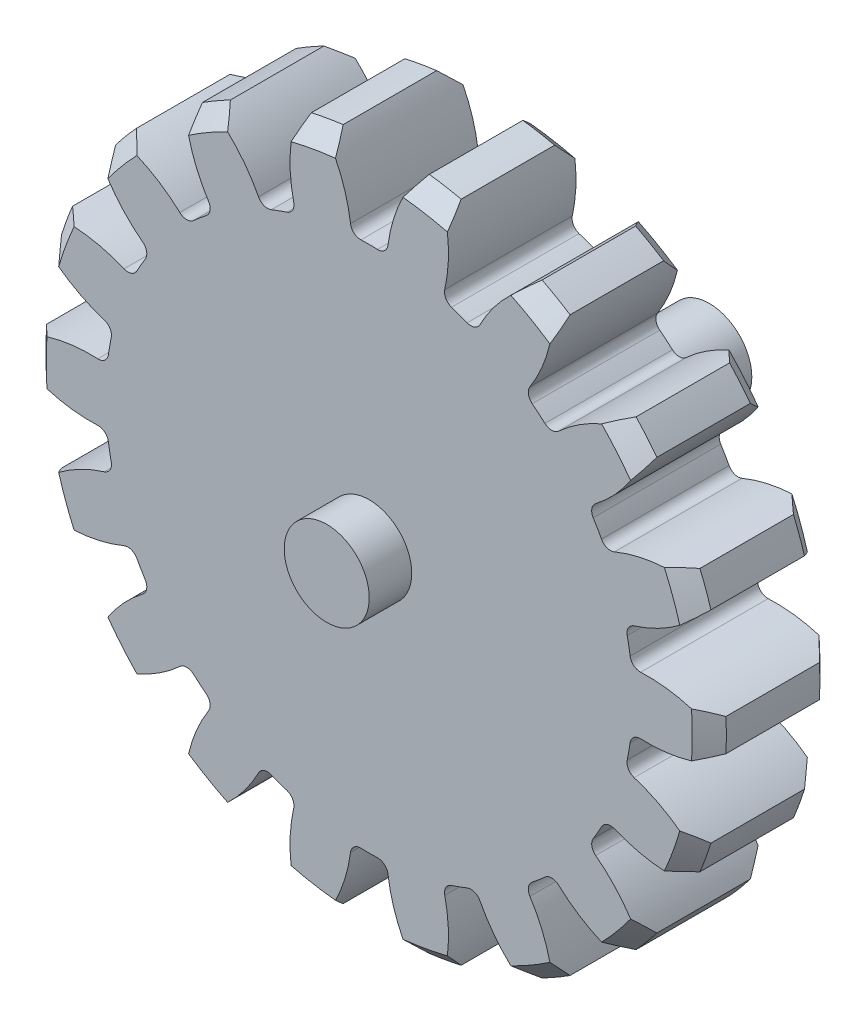
from build123d import *

# Parameters (mm, degrees)
SKICA1_R                     = 20
P_IDAT_VYSUNUT_M1_DEPTH      = 7.5
ODEBRAT_VYSUNUT_M1_DEPTH     = 7.5
ZAOBLIT2_R                   = 0.6
ZKOSEN_1_SIZE                = 1
KRUHOV_POLE1_COUNT           = 18
ZAOBLIT2_OF_KRUHOV_POLE1_R   = 0.6
P_IDAT_VYSUNUT_M2_DEPTH      = 10
P_IDAT_VYSUNUT_M2_DEPTH_BACK = 12.5
SKICA3_R                     = 2.5


with BuildPart() as part:
    # Skica1 → Přidat vysunutím1 (new body)
    with BuildSketch(Plane.XY):
        Circle(SKICA1_R)
    extrude(amount=P_IDAT_VYSUNUT_M1_DEPTH)

    # Skica2 → Odebrat vysunutím1 (cut)
    with BuildSketch(Plane.XY):
        with BuildLine():
            ThreePointArc((1.04727229, 15.464579553), (0, 15.5), (-1.04727229, 15.464579553))
            ThreePointArc((-1.04727229, 15.464579553), (-1.50454186, 17.748849698), (-2.533487574, 19.838887083))
            ThreePointArc((-2.533487574, 19.838887083), (0, 20), (2.533487574, 19.838887083))
            ThreePointArc((2.533487574, 19.838887083), (1.50454186, 17.748849698), (1.04727229, 15.464579553))
        make_face()
    odebrat_vysunut_m1 = extrude(amount=ODEBRAT_VYSUNUT_M1_DEPTH, mode=Mode.SUBTRACT)

    # Zaoblit2
    zaoblit2_edges = [part.edges().sort_by_distance(p)[0] for p in [
        (1.04727229, 15.464579553, 3.75),
        (-1.04727229, 15.464579553, 3.75),
    ]]
    fillet(zaoblit2_edges, radius=ZAOBLIT2_R)

    # Zkosení1
    zkosen_1_edges = [part.edges().sort_by_distance(p)[0] for p in [
        (0, -20, 0),
        (0, -20, 7.5),
    ]]
    chamfer(zkosen_1_edges, length=ZKOSEN_1_SIZE)

    # Kruhové pole1: Odebrat vysunutím1 ×18 about axis
    kruhov_pole1_axis = Axis((0, 0, 7.5), (0, 0, -1))
    for i in range(1, KRUHOV_POLE1_COUNT):
        add(odebrat_vysunut_m1.rotate(kruhov_pole1_axis, i * 360 / KRUHOV_POLE1_COUNT), mode=Mode.SUBTRACT)

    # Zaoblit2 of Kruhové pole1
    zaoblit2_of_kruhov_pole1_edges = [part.edges().sort_by_distance(p)[0] for p in [
        (6.273311758, 14.173763071, 3.75),
        (4.305083672, 14.890139508, 3.75),
        (10.742697244, 11.17338158, 3.75),
        (9.138183008, 12.519728884, 3.75),
        (13.916354897, 6.825325369, 3.75),
        (12.869082607, 8.639254184, 3.75),
        (15.411494766, 1.654034187, 3.75),
        (15.047780916, 3.716757928, 3.75),
        (15.047780916, -3.716757928, 3.75),
        (15.411494766, -1.654034187, 3.75),
        (12.869082607, -8.639254184, 3.75),
        (13.916354897, -6.825325369, 3.75),
        (9.138183008, -12.519728884, 3.75),
        (10.742697244, -11.17338158, 3.75),
        (4.305083672, -14.890139508, 3.75),
        (6.273311758, -14.173763071, 3.75),
        (-1.04727229, -15.464579553, 3.75),
        (1.04727229, -15.464579553, 3.75),
        (-6.273311758, -14.173763071, 3.75),
        (-4.305083672, -14.890139508, 3.75),
        (-10.742697244, -11.17338158, 3.75),
        (-9.138183008, -12.519728884, 3.75),
        (-13.916354897, -6.825325369, 3.75),
        (-12.869082607, -8.639254184, 3.75),
        (-15.411494766, -1.654034187, 3.75),
        (-15.047780916, -3.716757928, 3.75),
        (-15.047780916, 3.716757928, 3.75),
        (-15.411494766, 1.654034187, 3.75),
        (-12.869082607, 8.639254184, 3.75),
        (-13.916354897, 6.825325369, 3.75),
        (-9.138183008, 12.519728884, 3.75),
        (-10.742697244, 11.17338158, 3.75),
        (-4.305083672, 14.890139508, 3.75),
        (-6.273311758, 14.173763071, 3.75),
    ]]
    fillet(zaoblit2_of_kruhov_pole1_edges, radius=ZAOBLIT2_OF_KRUHOV_POLE1_R)

    # Skica3 → Přidat vysunutím2 (add, two sides: drawn at the far end of the back side and taken through both)
    with BuildSketch(Plane.XY.offset(-P_IDAT_VYSUNUT_M2_DEPTH_BACK)):
        Circle(SKICA3_R)
    extrude(amount=P_IDAT_VYSUNUT_M2_DEPTH + P_IDAT_VYSUNUT_M2_DEPTH_BACK)


solid = part.part
